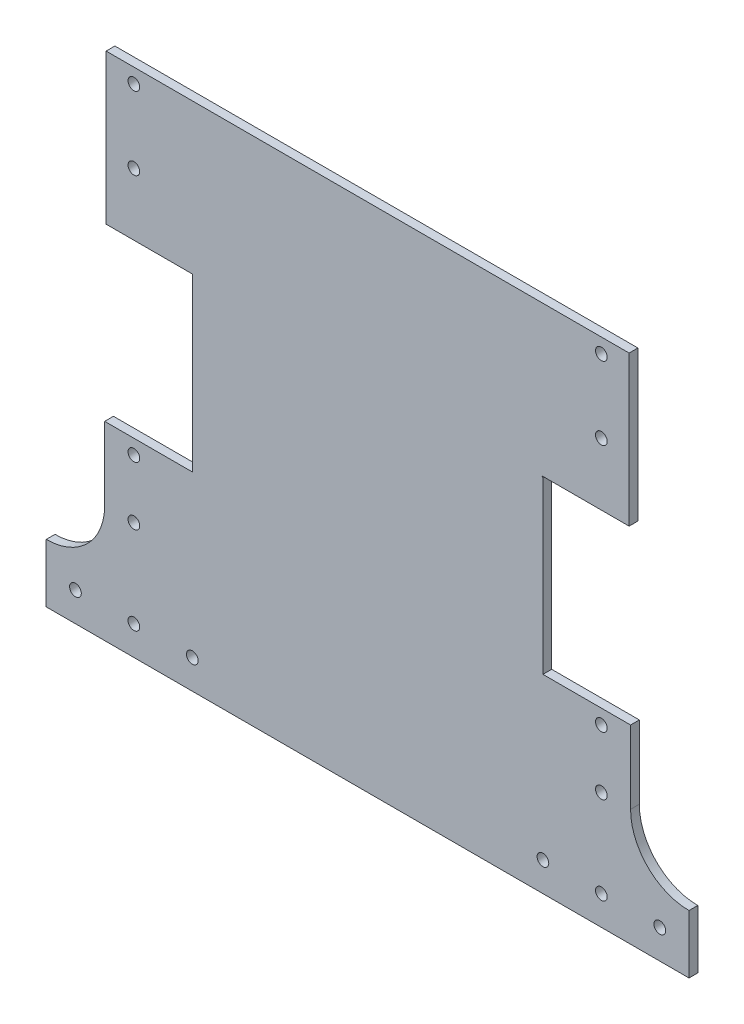
from build123d import *

# Parameters (mm, degrees)
EXTRUDE_1_DEPTH     = 3
FILLET_2_R          = 20
SKETCH_2_R          = 2
CUT_EXTRUDE_1_DEPTH = 3
CUT_EXTRUDE_2_DEPTH = 10


with BuildPart() as part:
    # 草图1 → 凸台-拉伸1 (new body)
    with BuildSketch(Plane.XY):
        Polygon((0, 65), (0, 20), (-20, 20), (-20, 0), (200, 0), (200, 20), (180, 20), (180, 65), (150, 65), (150, 123.180584191), (180, 123.180584191), (180, 175), (0, 175), (0, 123.180584191), (30, 123.180584191), (30, 65), align=None)
    extrude(amount=EXTRUDE_1_DEPTH)

    # 圆角2
    fillet_2_edges = [part.edges().sort_by_distance(p)[0] for p in [
        (0, 20, 1.5),
        (180, 20, 1.5),
    ]]
    fillet(fillet_2_edges, radius=FILLET_2_R - 0.0001)  # a hair under: the kernel refuses the full size

    # 草图2 → 切除-拉伸1 (cut)
    with BuildSketch(Plane.XY.offset(3)):
        with Locations((170, 10)):
            Circle(SKETCH_2_R)
        with Locations((190, 10)):
            Circle(SKETCH_2_R)
        with Locations((170, 40)):
            Circle(SKETCH_2_R)
        with Locations((150, 10)):
            Circle(SKETCH_2_R)
        with Locations(Location((30, 10, 0), (0, 0, 180))):
            Circle(SKETCH_2_R)
        with Locations(Location((10, 40, 0), (0, 0, 180))):
            Circle(SKETCH_2_R)
        with Locations(Location((-10, 10, 0), (0, 0, 180))):
            Circle(SKETCH_2_R)
        with Locations(Location((10, 10, 0), (0, 0, 180))):
            Circle(SKETCH_2_R)
        with Locations((170, 145)):
            Circle(SKETCH_2_R)
        with Locations(Location((10, 145, 0), (0, 0, 180))):
            Circle(SKETCH_2_R)
        with Locations((170, 60)):
            Circle(SKETCH_2_R)
        with Locations(Location((10, 60, 0), (0, 0, 180))):
            Circle(SKETCH_2_R)
        with Locations((170, 170)):
            Circle(SKETCH_2_R)
        with Locations(Location((10, 170, 0), (0, 0, 180))):
            Circle(SKETCH_2_R)
    extrude(amount=-CUT_EXTRUDE_1_DEPTH, mode=Mode.SUBTRACT)

    # 草图4 → 切除-拉伸2 (cut)
    with BuildSketch(Plane.XY.offset(3)):
        Polygon((0.5, 175), (0.5, 123.680584191), (30.055288572, 123.680584191), (30, 123.180584191), (-10.698425682, 117.187764406), (-9.272714691, 179.443811016), (-1.573875339, 179.443811016), align=None)
        Polygon((179.5, 175), (179.5, 123.680584191), (149.725032109, 123.680584191), (150, 123.180584191), (194.189444242, 109.302917778), (194.429656629, 189.306403842), (181.700722274, 189.306403842), align=None)
    extrude(amount=-CUT_EXTRUDE_2_DEPTH, mode=Mode.SUBTRACT)


solid = part.part
